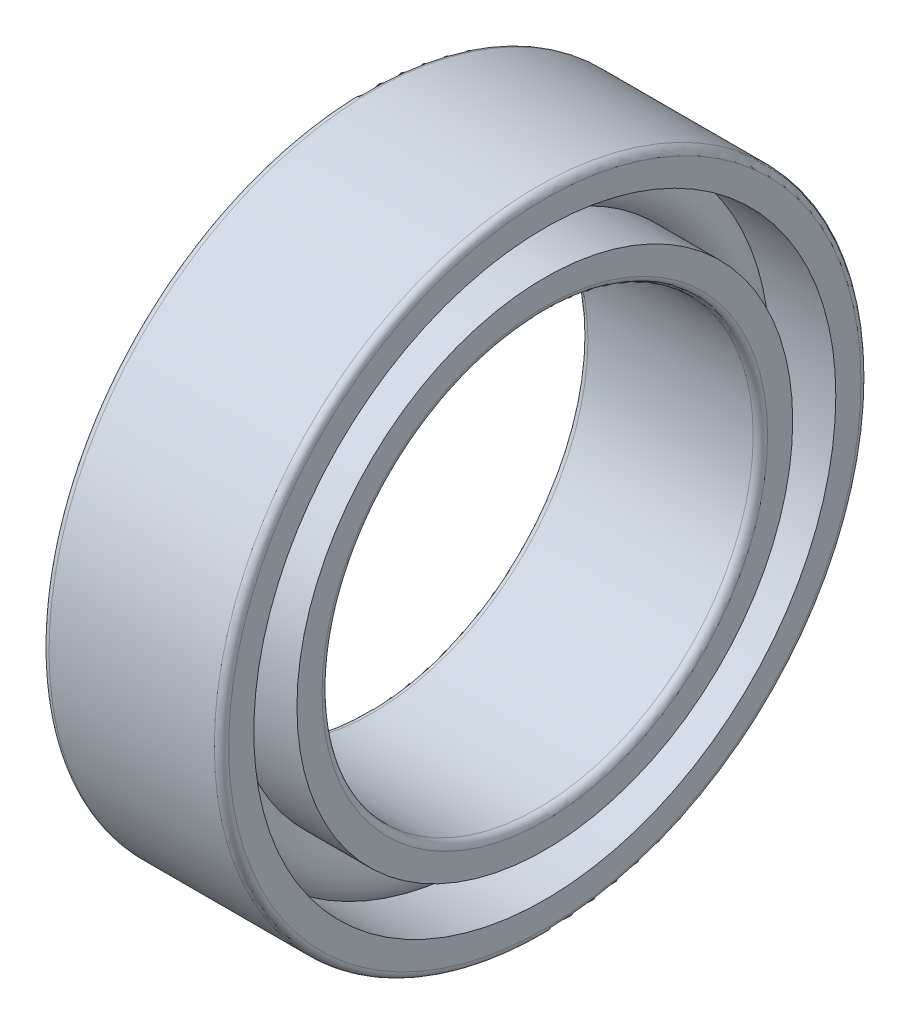
from build123d import *

# Parameters (mm, degrees)
CAGSPISKE_W     = 0.18
CAGSPISKE_H     = 0.3
CAGESPINE_ANGLE = 0.001
BALSIMSKE_R     = 0.9


with BuildPart() as part:
    # CagSpiSke → CageSpine (revolve)
    with BuildSketch(Plane.XY):
        with Locations((0, 7.5)):
            Rectangle(CAGSPISKE_W, CAGSPISKE_H)
    revolve(axis=Axis((-20.6375, 0, 0), (-1, 0, 0)), revolution_arc=CAGESPINE_ANGLE)

    # BalSimSke → BallsSimplified (revolve)
    with BuildSketch(Plane.XY):
        with Locations((0, 7.5)):
            Circle(BALSIMSKE_R)
    revolve(axis=Axis((-10, 0, 0), (1, 0, 0)))

    # InnRacSke → InnerRace (revolve)
    with BuildSketch(Plane.XY):
        with BuildLine():
            Line((-0.63688696, 6.9), (-2.5, 6.9))
            Line((-2.5, 6.9), (-2.5, 6.2))
            ThreePointArc((-2.5, 6.2), (-2.441421356, 6.058578644), (-2.3, 6))
            Line((-2.3, 6), (2.3, 6))
            ThreePointArc((2.3, 6), (2.441421356, 6.058578644), (2.5, 6.2))
            Line((2.5, 6.2), (2.5, 6.9))
            Line((2.5, 6.9), (0.63688696, 6.9))
            ThreePointArc((0.63688696, 6.9), (0, 6.625), (-0.63688696, 6.9))
        make_face()
    revolve(axis=Axis((-20.6375, 0, 0), (1, 0, 0)))

    # OutRacSke → OuterRace (revolve)
    with BuildSketch(Plane.XY):
        with BuildLine():
            Line((-0.63688696, 8.1), (-2.5, 8.1))
            Line((-2.5, 8.1), (-2.5, 8.8))
            ThreePointArc((-2.5, 8.8), (-2.441421356, 8.941421356), (-2.3, 9))
            Line((-2.3, 9), (2.3, 9))
            ThreePointArc((2.3, 9), (2.441421356, 8.941421356), (2.5, 8.8))
            Line((2.5, 8.8), (2.5, 8.1))
            Line((2.5, 8.1), (0.63688696, 8.1))
            ThreePointArc((0.63688696, 8.1), (0, 8.375), (-0.63688696, 8.1))
        make_face()
    revolve(axis=Axis((-20.6375, 0, 0), (1, 0, 0)))


solid = part.part
